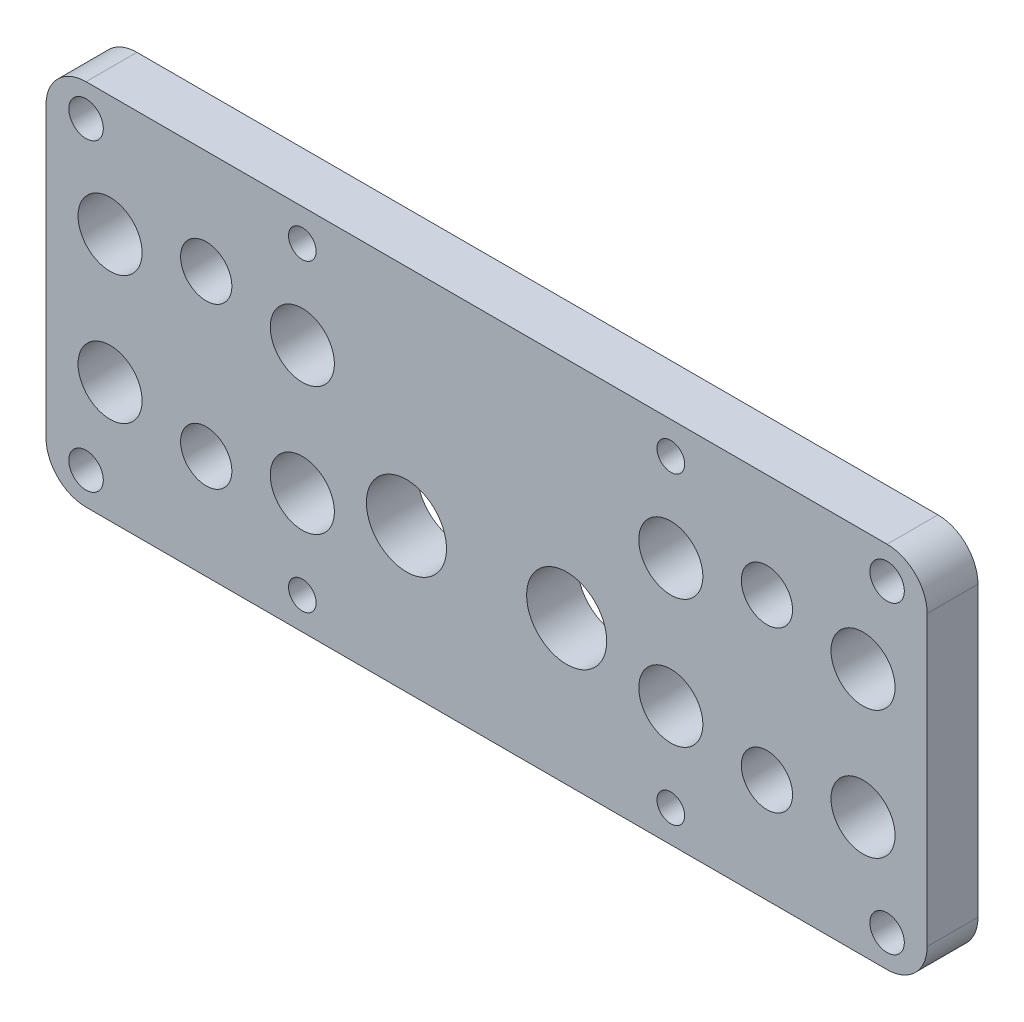
from build123d import *

# Parameters (mm, degrees)
SKETCH1_W             = 110
SKETCH1_H             = 46
BOSS_EXTRUDE1_DEPTH   = 6.35
M6_CLEARANCE_HOLE1_D  = 6.4
SKETCH5_R             = 5
CUT_EXTRUDE1_DEPTH    = 60.952668831
SKETCH7_R             = 4
CUT_EXTRUDE2_DEPTH    = 60.952668831
FILLET1_R             = 5
F_8_32_TAPPED_HOLE1_D = 3.4544
F_8_CLEARANCE_HOLE1_D = 4.3053


with BuildPart() as part:
    # Sketch1 → Boss-Extrude1 (new body)
    with BuildSketch(Plane.XY):
        Rectangle(SKETCH1_W, SKETCH1_H)
    extrude(amount=BOSS_EXTRUDE1_DEPTH)

    # M6 Clearance Hole1 (through all)
    with Locations(Plane(origin=(0, 0, 0), x_dir=(-1, 0, 0), z_dir=(0, 0, -1))):
        with Locations((-35, 10), (-35, -10), (35, -10), (35, 10)):
            Hole(M6_CLEARANCE_HOLE1_D / 2)

    # Sketch5 → Cut-Extrude1 (cut, through all)
    with BuildSketch(Plane(origin=(0, 0, 0), x_dir=(-1, 0, 0), z_dir=(0, 0, -1))):
        with Locations((-10, -5)):
            Circle(SKETCH5_R)
        with Locations((10, -5)):
            Circle(SKETCH5_R)
    extrude(amount=-CUT_EXTRUDE1_DEPTH, mode=Mode.SUBTRACT)

    # Sketch7 → Cut-Extrude2 (cut, through all)
    with BuildSketch(Plane(origin=(0, 0, 0), x_dir=(-1, 0, 0), z_dir=(0, 0, -1))):
        with Locations((-23, 8)):
            Circle(SKETCH7_R)
        with Locations((-23, -8)):
            Circle(SKETCH7_R)
        with Locations((23, -8)):
            Circle(SKETCH7_R)
        with Locations((23, 8)):
            Circle(SKETCH7_R)
        with Locations((-47, 8)):
            Circle(SKETCH7_R)
        with Locations((-47, -8)):
            Circle(SKETCH7_R)
        with Locations((47, 8)):
            Circle(SKETCH7_R)
        with Locations((47, -8)):
            Circle(SKETCH7_R)
    extrude(amount=-CUT_EXTRUDE2_DEPTH, mode=Mode.SUBTRACT)

    # Fillet1
    fillet1_edges = [part.edges().sort_by_distance(p)[0] for p in [
        (-55, 23, 3.175),
        (-55, -23, 3.175),
        (55, -23, 3.175),
        (55, 23, 3.175),
    ]]
    fillet(fillet1_edges, radius=FILLET1_R)

    # #8-32 Tapped Hole1 (through all)
    with Locations(Plane(origin=(0, 0, 0), x_dir=(-1, 0, 0), z_dir=(0, 0, -1))):
        with Locations((-23, 19), (23, 19), (23, -19), (-23, -19)):
            Hole(F_8_32_TAPPED_HOLE1_D / 2)

    # #8 Clearance Hole1 (through all)
    with Locations(Plane(origin=(0, 0, 0), x_dir=(-1, 0, 0), z_dir=(0, 0, -1))):
        with Locations((-50, 19), (-50, -19), (50, -19), (50, 19)):
            Hole(F_8_CLEARANCE_HOLE1_D / 2)


solid = part.part
